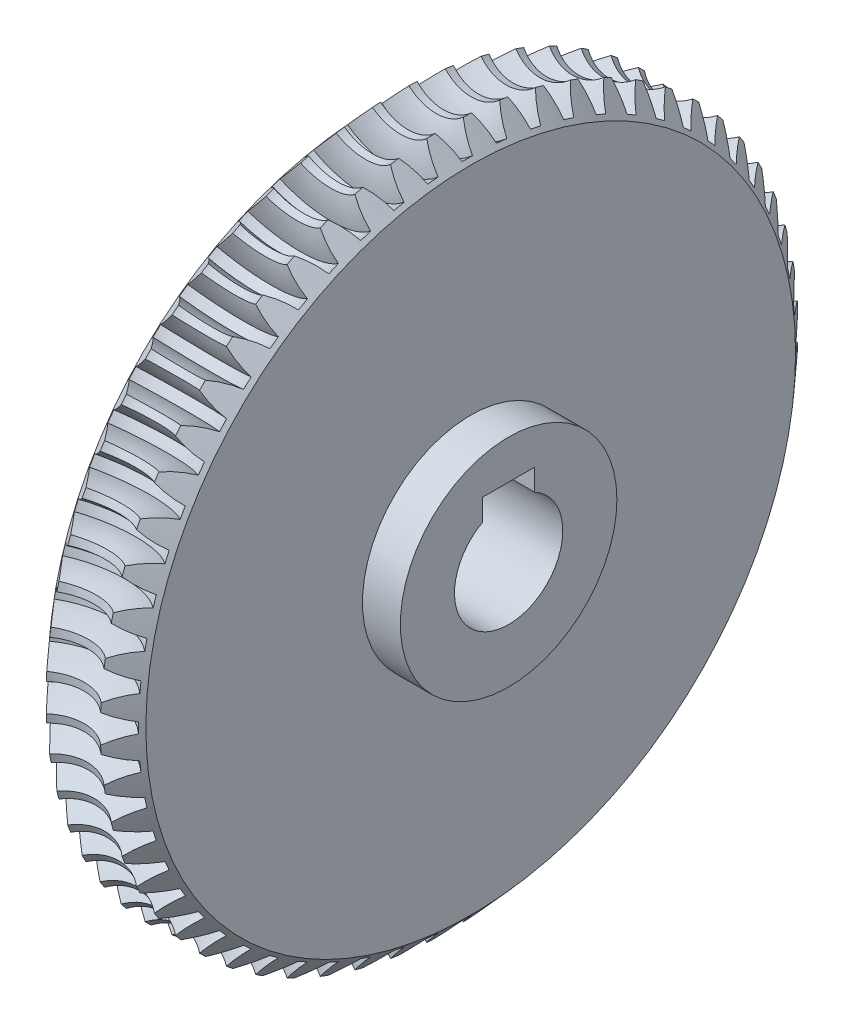
from build123d import *
from build123d.topology import SkipClean

# Parameters (mm, degrees)
MATRIZC1_COUNT          = 60
CROQUIS3_R              = 12.5
SALIENTE_EXTRUIR1_DEPTH = 10


with BuildPart() as part:
    # Croquis1 → Revolución1 (revolve)
    with BuildSketch(Plane.XY, mode=Mode.PRIVATE) as revoluci_n1_sk:
        with BuildLine():
            Line((-3.135772179, 40.265808689), (-5.625, 37.5))
            Line((-5.625, 37.5), (-5.625, 6.25))
            Line((-5.625, 6.25), (5.625, 6.25))
            Line((5.625, 6.25), (5.625, 37.5))
            Line((5.625, 37.5), (3.135772179, 40.265808689))
            ThreePointArc((3.135772179, 40.265808689), (0, 39.0625), (-3.135772179, 40.265808689))
        make_face()
    revolve(revoluci_n1_sk.sketch.rotate(Axis((0, 0, 0), (-1, 0, 0)), 90), axis=Axis((0, 0, 0), (-1, 0, 0)))

    # Croquis2 → Cortar-Revolución2 (revolve, cut)
    with BuildSketch(Plane(origin=(0, 0, 0), x_dir=(0, 0, -1), z_dir=(1, 0, 0))):
        with BuildLine():
            Line((-3.307072114, 41.441084503), (3.307072114, 41.441084503))
            ThreePointArc((3.307072114, 41.441084503), (1.550240619, 38.884883619), (0.599422923, 35.932500587))
            ThreePointArc((0.599422923, 35.932500587), (0, 35.9375), (-0.599422923, 35.932500587))
            ThreePointArc((-0.599422923, 35.932500587), (-1.550240619, 38.884883619), (-3.307072114, 41.441084503))
        make_face()
    cortar_revoluci_n2 = revolve(axis=Axis((0, 43.75, 0), (0, 0, -1)), mode=Mode.SUBTRACT)

    # MatrizC1: Cortar-Revolución2 ×60 about axis
    matrizc1_axis = Axis((0, 0, 0), (-1, 0, 0))
    for i in range(1, MATRIZC1_COUNT):
        add(cortar_revoluci_n2.rotate(matrizc1_axis, i * 360 / MATRIZC1_COUNT), mode=Mode.SUBTRACT)

    # Croquis3 → Saliente-Extruir1 (add, symmetric)
    with SkipClean():  # the faces are left unmerged after this step: merging them gives an invalid solid
        with BuildSketch(Plane(origin=(0, 0, 0), x_dir=(0, 0, -1), z_dir=(1, 0, 0))):
            Circle(CROQUIS3_R)
            with BuildLine():
                ThreePointArc((6.25, 0), (-3.186887196, -5.376453292), (-3, 5.48292805))
                Line((-3, 5.48292805), (-3, 7.98292805))
                Line((-3, 7.98292805), (3, 7.98292805))
                Line((3, 7.98292805), (3, 5.48292805))
                ThreePointArc((3, 5.48292805), (5.376453292, 3.186887196), (6.25, 0))
            make_face(mode=Mode.SUBTRACT)
        extrude(amount=SALIENTE_EXTRUIR1_DEPTH, both=True)


solid = part.part
